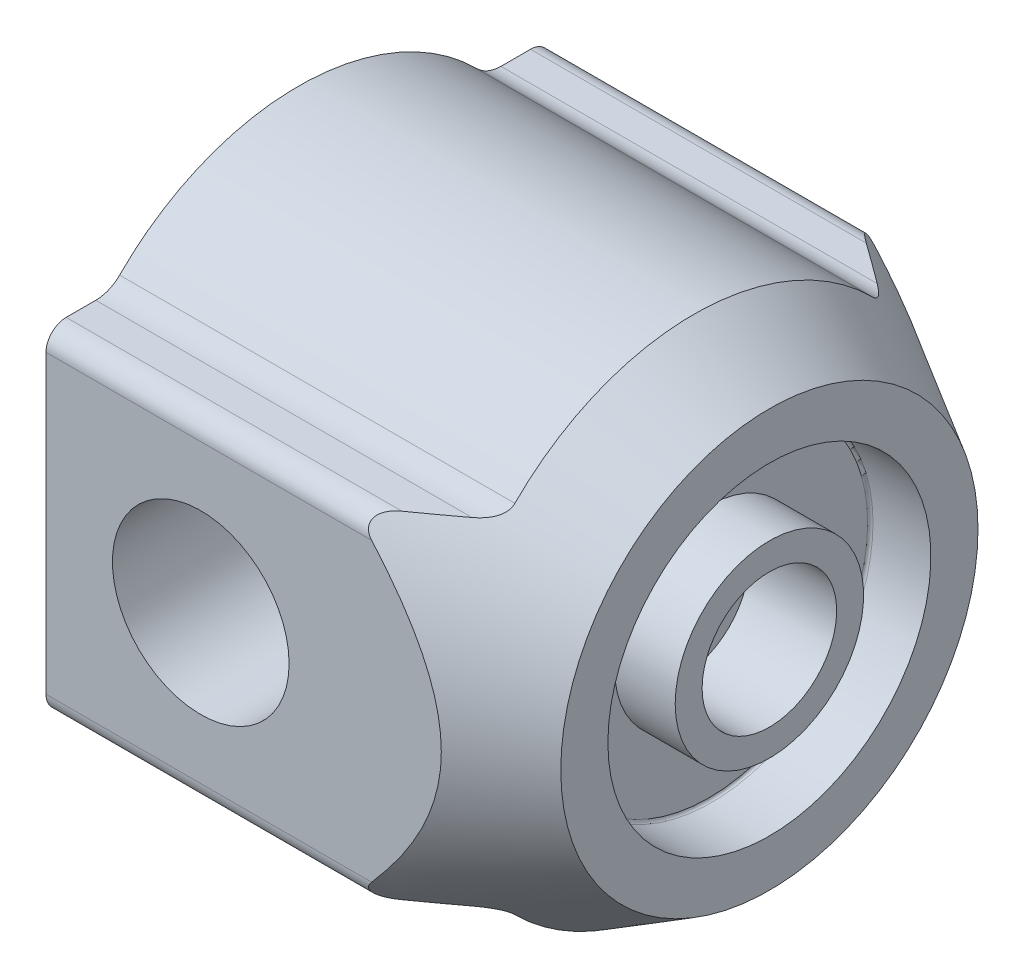
from build123d import *
from build123d.topology import SkipClean

# Parameters (mm, degrees)
SKETCH7_OUTSIDE_W   = 102.416
SKETCH7_OUTSIDE_H   = 102.416
SKETCH7_OUTSIDE_W_2 = 74
SKETCH7_OUTSIDE_H_2 = 80
CUT_EXTRUDE4_DEPTH  = 58.741669751
EXTRUDE4_START      = -58.741669751
EXTRUDE4_DEPTH      = 58.741669751
FILLET2_R           = 5
SKETCH4_R           = 13.125
CUT_EXTRUDE1_DEPTH  = 45
FILLET1_R           = 0.4


with BuildPart() as part:
    # Sketch1 → Base-Revolve (revolve)
    with BuildSketch(Plane.XY, mode=Mode.PRIVATE) as base_revolve_sk:
        Polygon((-23, 0), (-23, 37.5), (35.741669751, 37.5), (47, 31), (47, 24), (38, 24), (38, 14), (47, 14), (47, 10), (34, 10), (34, 6), (25, 6), (21.535898385, 0), align=None)
    revolve(base_revolve_sk.sketch.rotate(Axis((-65.592135762, 0, 0), (1, 0, 0)), 90), axis=Axis((-65.592135762, 0, 0), (1, 0, 0)))

    # Sketch2 → Cut-Revolve1 (revolve, cut)
    with BuildSketch(Plane.XY, mode=Mode.PRIVATE) as cut_revolve1_sk:
        Polygon((-23, 36), (-21.5, 36), (-21.5, 31.65), (39, 31.65), (43.416729559, 24), (-23, 24), align=None)
    revolve(cut_revolve1_sk.sketch.rotate(Axis((-29.427152318, 24, 0), (1, 0, 0)), 90), axis=Axis((-29.427152318, 24, 0), (1, 0, 0)), mode=Mode.SUBTRACT)

    # Sketch3 → Cut-Revolve2 (revolve, cut)
    with BuildSketch(Plane.XY, mode=Mode.PRIVATE) as cut_revolve2_sk:
        Polygon((-23, -36), (-21.5, -36), (-21.5, -31.65), (29, -31.65), (33.416729559, -24), (-23, -24), align=None)
    revolve(cut_revolve2_sk.sketch.rotate(Axis((-27.440397351, -24, 0), (1, 0, 0)), 270), axis=Axis((-27.440397351, -24, 0), (1, 0, 0)), mode=Mode.SUBTRACT)

    # Sketch7 outside → Cut-Extrude4 (cut)
    with BuildSketch(Plane.ZY.offset(-35.741669751)):
        Rectangle(SKETCH7_OUTSIDE_W, SKETCH7_OUTSIDE_H)
        Rectangle(SKETCH7_OUTSIDE_W_2, SKETCH7_OUTSIDE_H_2, mode=Mode.SUBTRACT)
    extrude(amount=CUT_EXTRUDE4_DEPTH, mode=Mode.SUBTRACT)

    # Sketch8 → Extrude4 (add)
    with BuildSketch(Plane.ZY.offset(23).offset(EXTRUDE4_START)):
        with BuildLine():
            Line((-27.950849719, 25), (-34.5, 25))
            ThreePointArc((-34.5, 25), (-36.621320344, 24.121320344), (-37.5, 22))
            Line((-37.5, 22), (-37.5, -22))
            ThreePointArc((-37.5, -22), (-36.621320344, -24.121320344), (-34.5, -25))
            Line((-34.5, -25), (-27.950849719, -25))
            ThreePointArc((-27.950849719, -25), (-33.821956584, -16.196458033), (-37, -6.103277808))
            Line((-37, -6.103277808), (-37, 6.103277808))
            ThreePointArc((-37, 6.103277808), (-33.821956584, 16.196458033), (-27.950849719, 25))
        make_face()
        with BuildLine():
            Line((34.5, -25), (27.950849719, -25))
            ThreePointArc((27.950849719, -25), (33.821956584, -16.196458033), (37, -6.103277808))
            Line((37, -6.103277808), (37, 6.103277808))
            ThreePointArc((37, 6.103277808), (33.821956584, 16.196458033), (27.950849719, 25))
            Line((27.950849719, 25), (34.5, 25))
            ThreePointArc((34.5, 25), (36.621320344, 24.121320344), (37.5, 22))
            Line((37.5, 22), (37.5, -22))
            ThreePointArc((37.5, -22), (36.621320344, -24.121320344), (34.5, -25))
        make_face()
    extrude(amount=EXTRUDE4_DEPTH)

    # Fillet2
    # the kernel refuses this fillet: 5 mm, written as the material it adds along each edge
    with BuildSketch(Plane(origin=(35.741669751, 25, -27.950849719), x_dir=(0, 0, -1), z_dir=(-1, 0, 0)), Plane(origin=(35.741669751, -25, 27.950849719), x_dir=(0, 0, 1), z_dir=(-1, 0, 0))) as fillet2_piece_1:
        with BuildLine():
            CenterArc((2.153136728, -5), FILLET2_R, 90, 45.099127844)
            ThreePointArc((-1.388508736, -1.470588235), (-0.684338252, -0.744656775), (0, 0))
            Line((0, 0), (2.153136728, 0))
        make_face()
    extrude(amount=58.741669751)
    with BuildSketch(Plane(origin=(35.741669751, -25, -27.950849719), x_dir=(0, 0, -1), z_dir=(-1, 0, 0))) as fillet2_piece_2:
        with BuildLine():
            CenterArc((2.153136728, 5), FILLET2_R, 224.900872156, 45.099127844)
            ThreePointArc((-1.388508736, 1.470588235), (-0.684338252, 0.744656775), (0, 0))
            Line((0, 0), (2.153136728, 0))
        make_face()
    extrude(amount=58.741669751)
    with BuildSketch(Plane(origin=(35.741669751, 25, 27.950849719), x_dir=(0, 0.7271069724389511, -0.6865241806598386), z_dir=(-1, 0, 0))) as fillet2_piece_3:
        with BuildLine():
            CenterArc((2.157354434, -4.998181631), FILLET2_R, 91.54527863, 45.099127844)
            Line((-1.478180428, -1.565560728), (0, 0))
            ThreePointArc((0, 0), (1.011259891, -0.013637767), (2.022519782, 0))
        make_face()
    extrude(amount=58.741669751)

    # Sketch4 → Cut-Extrude1 (cut, symmetric)
    with BuildSketch(Plane.XY):
        Circle(SKETCH4_R)
    extrude(amount=CUT_EXTRUDE1_DEPTH, both=True, mode=Mode.SUBTRACT)

    # Sketch5 → Cut-Revolve3 (revolve, cut)
    with BuildSketch(Plane(origin=(24, 0, 0), x_dir=(0, 0, -1), z_dir=(1, 0, 0)), mode=Mode.PRIVATE) as cut_revolve3_sk:
        Polygon((16.059493946, -34.439695907), (25.122571817, -30.21351329), (24.277335293, -28.400897716), (20.561473366, -30.133632589), (2.811506373, 7.931294466), (-3.975302297, 8.525063287), align=None)
    revolve(cut_revolve3_sk.sketch.rotate(Axis((24, 0, 0), (0, -0.9063077870366493, -0.422618261740701)), 180), axis=Axis((24, 0, 0), (0, -0.9063077870366493, -0.422618261740701)), mode=Mode.SUBTRACT)

    # Fillet1
    fillet1_edges = [part.edges().sort_by_distance(p)[0] for p in [
        (38, -19.458330429, -14.048963553),
    ]]
    fillet(fillet1_edges, radius=FILLET1_R)

    # Sketch9 → Cut-Revolve4 (revolve, cut)
    with SkipClean():  # the faces are left unmerged after this step: merging them gives an invalid solid
        with BuildSketch(Plane.XY, mode=Mode.PRIVATE) as cut_revolve4_sk:
            Polygon((47, 31), (7, 54.094010768), (47, 54.094010768), align=None)
        revolve(cut_revolve4_sk.sketch.rotate(Axis((0, 0, 0), (1, 0, 0)), 90), axis=Axis((0, 0, 0), (1, 0, 0)), mode=Mode.SUBTRACT)


solid = part.part
